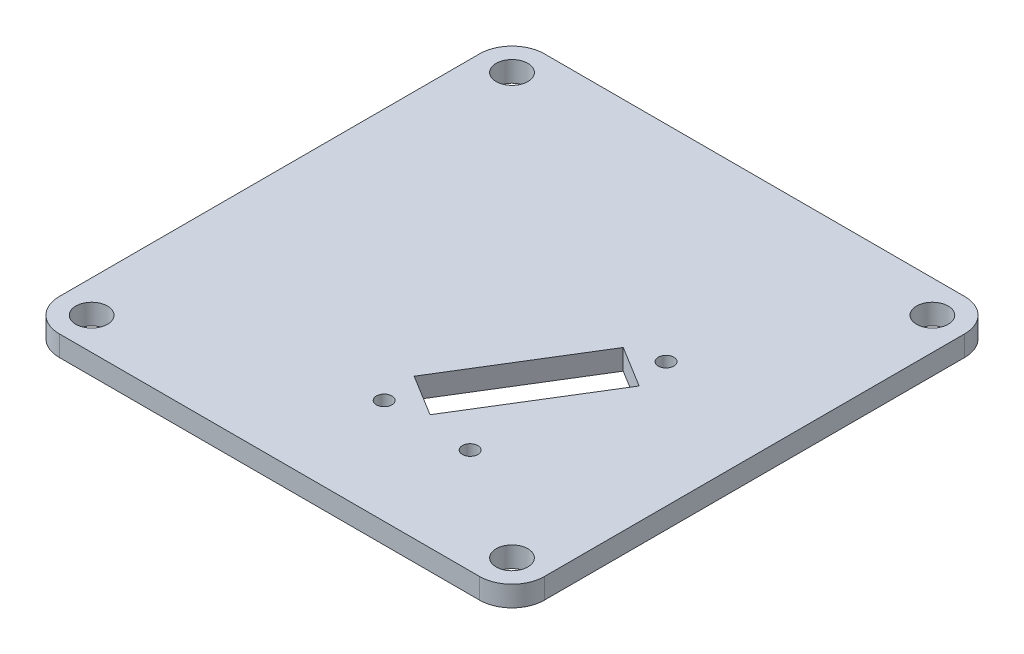
from build123d import *

# Parameters (mm, degrees)
BOSS_EXTRUDE1_DEPTH = 6.35
SKETCH2_R           = 2.4
SKETCH2_R_2         = 4.9
CUT_EXTRUDE1_DEPTH  = 213.227054119


with BuildPart() as part:
    # Sketch1 → Boss-Extrude1 (new body)
    with BuildSketch(Plane(origin=(0, 0, 0), x_dir=(1, 0, 0), z_dir=(0, 1, 0))):
        with BuildLine():
            Line((10, 0), (140, 0))
            ThreePointArc((140, 0), (147.071067812, 2.928932188), (150, 10))
            Line((150, 10), (150, 140))
            ThreePointArc((150, 140), (147.071067812, 147.071067812), (140, 150))
            Line((140, 150), (10, 150))
            ThreePointArc((10, 150), (2.928932188, 147.071067812), (0, 140))
            Line((0, 140), (0, 10))
            ThreePointArc((0, 10), (2.928932188, 2.928932188), (10, 0))
        make_face()
    extrude(amount=BOSS_EXTRUDE1_DEPTH)

    # Sketch2 → Cut-Extrude1 (cut, through all)
    with BuildSketch(Plane(origin=(0, 6.35, 0), x_dir=(1, 0, 0), z_dir=(0, 1, 0))):
        with Locations((78.068159546, 32.4)):
            Circle(SKETCH2_R)
        with Locations((104.650093785, 32.4)):
            Circle(SKETCH2_R)
        with Locations((111.276700611, 86.369381637)):
            Circle(SKETCH2_R)
        with Locations((10, 140)):
            Circle(SKETCH2_R_2)
        with Locations((10, 10)):
            Circle(SKETCH2_R_2)
        with Locations((140, 140)):
            Circle(SKETCH2_R_2)
        with Locations((140, 10)):
            Circle(SKETCH2_R_2)
        Polygon((76.221773799, 43.519873691), (88.997006301, 35.658993682), (113.627763661, 75.688055524), (100.852531159, 83.548935532), align=None)
    extrude(amount=-CUT_EXTRUDE1_DEPTH, mode=Mode.SUBTRACT)


solid = part.part
